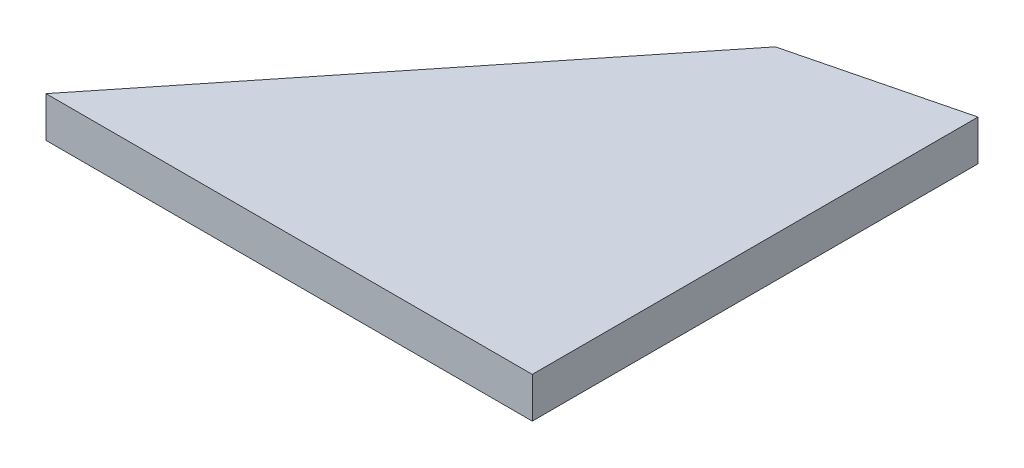
from build123d import *

# Parameters (mm, degrees)
BOSS_EXTRUDE1_DEPTH = 2.5


with BuildPart() as part:
    # Sketch1 → Boss-Extrude1 (new, symmetric)
    with BuildSketch(Plane(origin=(0, 0, 0), x_dir=(1, 0, 0), z_dir=(0, 1, 0))):
        Polygon((0, 0), (40, 50), (60, 55), (60, 0), align=None)
    extrude(amount=BOSS_EXTRUDE1_DEPTH, both=True)


solid = part.part
